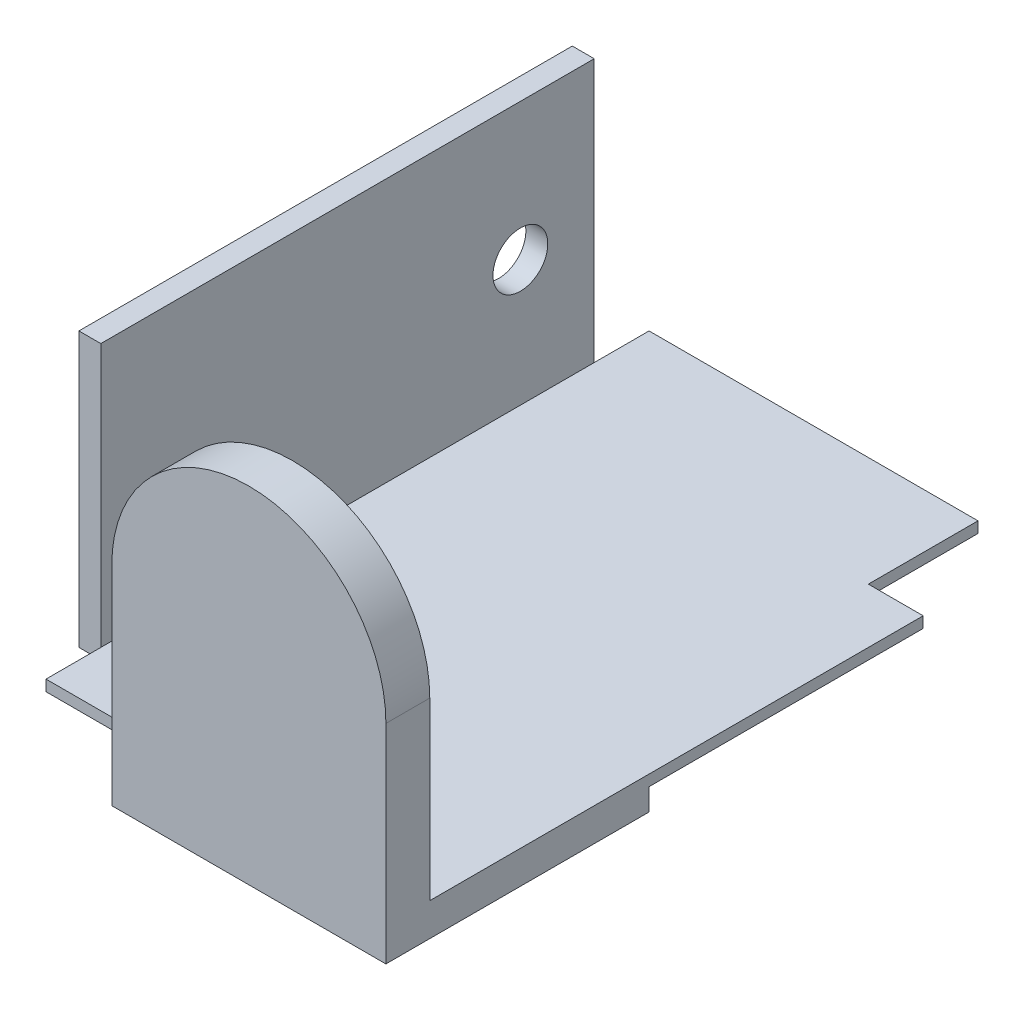
from build123d import *

# Parameters (mm, degrees)
ESQUISSE1_W             = 35
ESQUISSE1_H             = 55
BOSS_EXTRU_1_DEPTH      = 1
ESQUISSE2_W             = 45
ESQUISSE2_H             = 25
BOSS_EXTRU_2_DEPTH      = 2
ESQUISSE3_W             = 5
ESQUISSE3_H             = 10
ENL_V_MAT_EXTRU_1_DEPTH = 2
ESQUISSE5_W             = 25
ESQUISSE5_H             = 20
BOSS_EXTRU_3_DEPTH      = 2
BOSS_EXTRU_4_DEPTH      = 2
SYM_TRIE1_DEPTH         = 4
ESQUISSE7_W             = 13.982195968
ESQUISSE7_H             = 28.94332856
ENL_V_MAT_EXTRU_2_DEPTH = 50
ESQUISSE8_R             = 2.5
ENL_V_MAT_EXTRU_3_DEPTH = 2


# Read off the part's stored shape, not the designer's step: Symétrie1
with BuildPart() as part:
    # Esquisse1 → Boss.-Extru.1 (new body)
    with BuildSketch(Plane(origin=(0, 0, 0), x_dir=(1, 0, 0), z_dir=(0, 1, 0))):
        with Locations((17.5, 27.5)):
            Rectangle(ESQUISSE1_W, ESQUISSE1_H)
    extrude(amount=BOSS_EXTRU_1_DEPTH)

    # Esquisse2 → Boss.-Extru.2 (add)
    with BuildSketch(Plane.ZY):
        with Locations((-27.5, 12.5)):
            Rectangle(ESQUISSE2_W, ESQUISSE2_H)
    extrude(amount=BOSS_EXTRU_2_DEPTH)

    # Esquisse3 → Enlèv. mat.-Extru.1 (cut)
    with BuildSketch(Plane(origin=(0, 0, 0), x_dir=(-1, 0, 0), z_dir=(0, -1, 0))):
        with Locations((-32.5, 50)):
            Rectangle(ESQUISSE3_W, ESQUISSE3_H)
    extrude(amount=-ENL_V_MAT_EXTRU_1_DEPTH, mode=Mode.SUBTRACT)

    # Esquisse5 → Boss.-Extru.3 (add)
    with BuildSketch(Plane(origin=(0, 0, 0), x_dir=(-1, 0, 0), z_dir=(0, -1, 0))):
        with Locations((-22.5, 10)):
            Rectangle(ESQUISSE5_W, ESQUISSE5_H)
    extrude(amount=BOSS_EXTRU_3_DEPTH)

    # Esquisse6 → Boss.-Extru.4 (add)
    with BuildSketch(Plane.XY):
        with BuildLine():
            Line((35, 1), (10, 1))
            Line((10, 1), (10, -15))
            ThreePointArc((10, -15), (22.5, -27.5), (35, -15))
            Line((35, -15), (35, 1))
        make_face()
    extrude(amount=BOSS_EXTRU_4_DEPTH)

    # Symétrie1 outline → Symétrie1 (add)
    with BuildSketch(Plane.XY):
        with BuildLine():
            Line((35, -15), (35, 17))
            ThreePointArc((35, 17), (22.5, 29.5), (10, 17))
            Line((10, 17), (10, -15))
            ThreePointArc((10, -15), (22.5, -27.5), (35, -15))
        make_face()
    extrude(amount=SYM_TRIE1_DEPTH)

    # Esquisse7 → Enlèv. mat.-Extru.2 (cut)
    with BuildSketch(Plane.ZY.offset(-10)):
        with Locations((6.991097984, -16.47166428)):
            Rectangle(ESQUISSE7_W, ESQUISSE7_H)
    extrude(amount=-ENL_V_MAT_EXTRU_2_DEPTH, mode=Mode.SUBTRACT)

    # Esquisse8 → Enlèv. mat.-Extru.3 (cut)
    with BuildSketch(Plane.ZY.offset(2)):
        with Locations((-43.263662177, 12.5)):
            Circle(ESQUISSE8_R)
    extrude(amount=-ENL_V_MAT_EXTRU_3_DEPTH, mode=Mode.SUBTRACT)


solid = part.part
